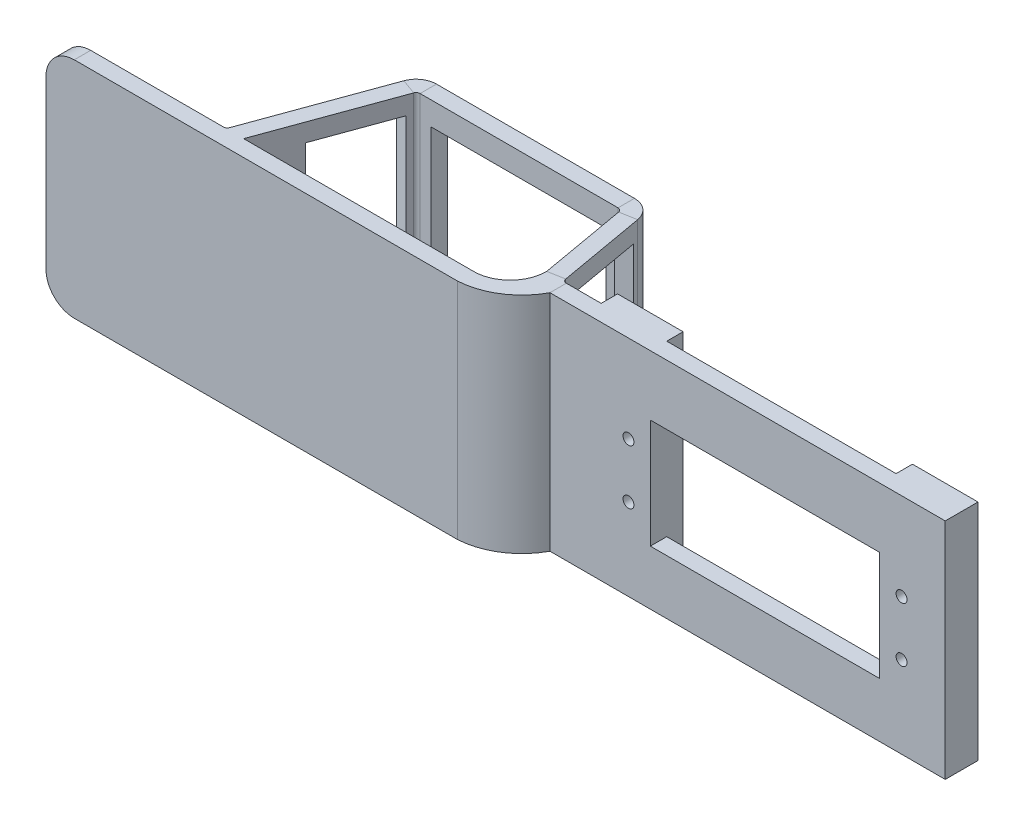
from build123d import *

# Parameters (mm, degrees)
BASE_FLANGE1_DEPTH  = 41
SKETCH2_W           = 42
SKETCH2_H           = 20
CUT_EXTRUDE1_DEPTH  = 10
BOSS_EXTRUDE1_DEPTH = 6
SKETCH5_R           = 1
CUT_EXTRUDE3_DEPTH  = 165.132308696
BOSS_EXTRUDE2_DEPTH = 41
SKETCH7_W           = 32.001348433
SKETCH7_H           = 33.78132576
CUT_EXTRUDE4_DEPTH  = 7
CUT_EXTRUDE5_START  = 2.509016302
CUT_EXTRUDE5_DEPTH  = 35.18539121
CUT_EXTRUDE6_START  = -3
CUT_EXTRUDE6_DEPTH  = 3


# Read off the part's stored shape, not the designer's step: Cut-Extrude5, Cut-Extrude6
# Sheet-metal steps are written as plain solids
with BuildPart() as part:
    # Sketch1 → Base-Flange1 (new body)
    with BuildSketch(Plane(origin=(0, 0, 0), x_dir=(1, 0, 0), z_dir=(0, 1, 0))):
        with BuildLine():
            Line((0, 0), (29.484227127, 0))
            ThreePointArc((29.484227127, 0), (29.90672353, 0.133212604), (30.176404712, 0.484667962))
            Line((30.176404712, 0.484667962), (38.681704054, 23.85278585))
            ThreePointArc((38.681704054, 23.85278585), (40.049733788, 25.635636911), (42.1929595, 26.311393382))
            Line((42.1929595, 26.311393382), (78.441184331, 26.311393382))
            ThreePointArc((78.441184331, 26.311393382), (80.843024514, 25.437195048), (82.121016981, 23.223647163))
            Line((82.121016981, 23.223647163), (84.942198964, 7.223929074))
            ThreePointArc((84.942198964, 7.223929074), (85.194131001, 6.787569985), (85.667608355, 6.615238322))
            Line((85.667608355, 6.615238322), (158.049527566, 6.615238322))
            Line((158.049527566, 6.615238322), (158.049527566, 3.615238322))
            Line((158.049527566, 3.615238322), (85.667608355, 3.615238322))
            ThreePointArc((85.667608355, 3.615238322), (83.265768172, 4.489436656), (81.987775705, 6.702984541))
            Line((81.987775705, 6.702984541), (79.166593722, 22.70270263))
            ThreePointArc((79.166593722, 22.70270263), (78.914661685, 23.139061719), (78.441184331, 23.311393382))
            Line((78.441184331, 23.311393382), (42.1929595, 23.311393382))
            ThreePointArc((42.1929595, 23.311393382), (41.770463097, 23.178180778), (41.500781916, 22.82672542))
            Line((41.500781916, 22.82672542), (32.995482574, -0.541392468))
            ThreePointArc((32.995482574, -0.541392468), (31.627452839, -2.324243529), (29.484227127, -3))
            Line((29.484227127, -3), (0, -3))
            Line((0, -3), (0, 0))
        make_face()
    extrude(amount=BASE_FLANGE1_DEPTH)

    # Sketch2 → Cut-Extrude1 (cut)
    with BuildSketch(Plane.XY.offset(-3.615238322)):
        with Locations((125.049527566, 20)):
            Rectangle(SKETCH2_W, SKETCH2_H)
    extrude(amount=-CUT_EXTRUDE1_DEPTH, mode=Mode.SUBTRACT)

    # Sketch3 → Boss-Extrude1 (add)
    with BuildSketch(Plane.XY.offset(-3.615238322)):
        Polygon((104.049527566, 30), (104.049527566, 41), (92.049527566, 41), (92.049527566, 0), (104.049527566, 0), (104.049527566, 10), align=None)
        Polygon((158.049527566, 0), (158.049527566, 41), (146.049527566, 41), (146.049527566, 30), (146.049527566, 10), (146.049527566, 0), align=None)
    extrude(amount=-BOSS_EXTRUDE1_DEPTH)

    # Sketch5 → Cut-Extrude3 (cut, through all)
    with BuildSketch(Plane(origin=(0, 0, -9.615238322), x_dir=(-1, 0, 0), z_dir=(0, 0, -1))):
        with Locations((-100.049527566, 25)):
            Circle(SKETCH5_R)
        with Locations((-100.049527566, 15)):
            Circle(SKETCH5_R)
        with Locations((-150.049527566, 15)):
            Circle(SKETCH5_R)
        with Locations((-150.049527566, 25)):
            Circle(SKETCH5_R)
    extrude(amount=-CUT_EXTRUDE3_DEPTH, mode=Mode.SUBTRACT)

    # Sketch6 → Boss-Extrude2 (add)
    with BuildSketch(Plane(origin=(0, 0, 0), x_dir=(-1, 0, 0), z_dir=(0, -1, 0))):
        with BuildLine():
            Line((-29.484227127, -3), (-75.34551542, -3))
            ThreePointArc((-75.34551542, -3), (-81.36937718, -1.03867544), (-85.667608355, 3.615238322))
            ThreePointArc((-85.667608355, 3.615238322), (-83.265768172, 4.489436656), (-81.987775705, 6.702984541))
            ThreePointArc((-81.987775705, 6.702984541), (-80.044156462, 1.965108483), (-75.315152978, 0))
            Line((-75.315152978, 0), (-29.484227127, 0))
            Line((-29.484227127, 0), (-29.484227127, -3))
        make_face()
    extrude(amount=-BOSS_EXTRUDE2_DEPTH)

    # Sketch7 → Cut-Extrude4 (cut)
    with BuildSketch(Plane.XY.offset(-23.311393382)):
        with Locations((60.232231791, 19.824471405)):
            Rectangle(SKETCH7_W, SKETCH7_H)
    extrude(amount=-CUT_EXTRUDE4_DEPTH, mode=Mode.SUBTRACT)

    # Cut-Extrude5 outline → Cut-Extrude5 (cut)
    with BuildSketch(Plane(origin=(0, 0, 0), x_dir=(1, 0, 0), z_dir=(0, 1, 0)).offset(CUT_EXTRUDE5_START)):
        Polygon((84.565358052, 9.361100086), (82.279466997, 22.325032469), (79.325043738, 21.804087936), (81.610934793, 8.840155553), align=None)
        Polygon((38.309494449, 22.830148366), (33.407161792, 9.361100086), (36.226239654, 8.335039656), (41.128572311, 21.804087936), align=None)
    extrude(amount=CUT_EXTRUDE5_DEPTH, mode=Mode.SUBTRACT)

    # Cut-Extrude6 outline → Cut-Extrude6 (cut)
    with BuildSketch(Plane.XY.offset(3).offset(CUT_EXTRUDE6_START)):
        with BuildLine():
            ThreePointArc((5.188265578, 0), (1.627560559, 1.417661865), (0, 4.887450335))
            Line((0, 4.887450335), (0, 0))
            Line((0, 0), (5.188265578, 0))
        make_face()
        with BuildLine():
            ThreePointArc((0, 35.818729295), (1.526422616, 39.473577384), (5.181270705, 41))
            Line((5.181270705, 41), (0, 41))
            Line((0, 41), (0, 35.818729295))
        make_face()
    extrude(amount=CUT_EXTRUDE6_DEPTH, mode=Mode.SUBTRACT)


solid = part.part
